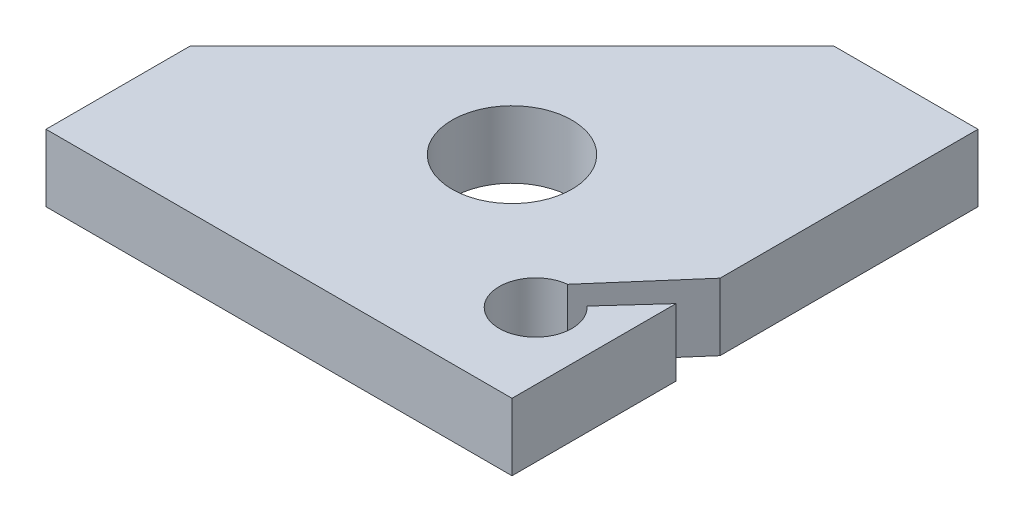
from build123d import *

# Parameters (mm, degrees)
SKETCH1_R           = 6.25
BOSS_EXTRUDE1_DEPTH = 7


with BuildPart() as part:
    # Sketch1 → Boss-Extrude1 (new body)
    with BuildSketch(Plane(origin=(0, 0, 0), x_dir=(1, 0, 0), z_dir=(0, 1, 0))):
        with BuildLine():
            Line((72.34, -63.405178012), (38.75, -96.995178012))
            Line((38.75, -96.995178012), (38.75, -111.995178012))
            Line((38.75, -111.995178012), (87.34, -111.995178012))
            Line((87.34, -111.995178012), (87.34, -94.896256746))
            Line((87.34, -94.896256746), (82.922661505, -99.760117279))
            ThreePointArc((82.922661505, -99.760117279), (79.206389469, -106.17642477), (79.948751144, -98.798852079))
            Line((79.948751144, -98.798852079), (87.34, -90.296256746))
            Line((87.34, -90.296256746), (87.34, -63.405178012))
            Line((87.34, -63.405178012), (72.34, -63.405178012))
        make_face()
        with Locations((65.34, -89.995178012)):
            Circle(SKETCH1_R, mode=Mode.SUBTRACT)
    extrude(amount=BOSS_EXTRUDE1_DEPTH)


solid = part.part
